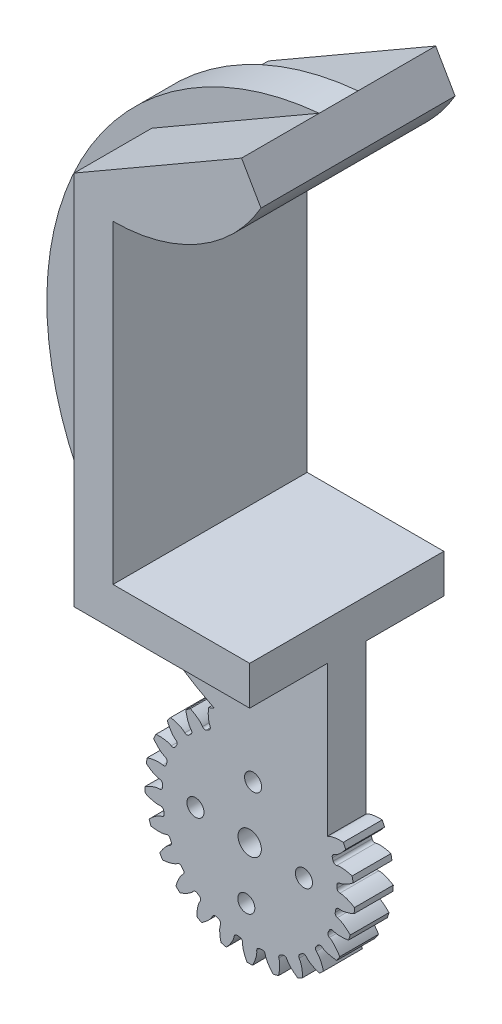
from build123d import *

# Parameters (mm, degrees)
SKETCH_1_R           = 13.5
LASHENA_DEPTH        = 5
CUT_EXTRUDEA_DEPTH   = 30
WWW_KYTOOL_CN_COUNT  = 25
EXTRUDE_2_DEPTH      = 10
EXTRUDE_2_DEPTH_BACK = 15
CUT_EXTRUDE_START    = -10
CUT_EXTRUDE_2_DEPTH  = 10
EXTRUDE_3_DEPTH      = 5
CUT_EXTRUDE_3_DEPTH  = 10
SKETCH_7_R           = 1.5
SKETCH_7_R_2         = 1.1
CUT_EXTRUDE_4_DEPTH  = 91.962557258
CUT_EXTRUDE_5_DEPTH  = 10


with BuildPart() as part:
    # 草图1 → LaShenA (new body)
    with BuildSketch(Plane.XY):
        Circle(SKETCH_1_R)
    extrude(amount=LASHENA_DEPTH)

    # SketchA → Cut-ExtrudeA (cut)
    with BuildSketch(Plane.XY.offset(5)):
        with BuildLine():
            ThreePointArc((0.168413676, 11.248739344), (0, 11.25), (-0.168413676, 11.248739344))
            ThreePointArc((-0.168413676, 11.248739344), (-0.431955465, 11.349569992), (-0.553318931, 11.60430908))
            add(Edge.make_bspline(
                [(-0.553318931, 11.60430908), (-0.556083603, 11.647298384), (-0.561050641, 11.7223845), (-0.572489313, 11.811624088), (-0.58477152, 11.87427273), (-0.59566003, 11.923918216), (-0.609744808, 11.980847357), (-0.62734241, 12.044939707), (-0.64885177, 12.116041497), (-0.674637893, 12.193990315), (-0.705068872, 12.278607345), (-0.740503482, 12.369700094), (-0.781294405, 12.467061823), (-0.827786595, 12.570472023), (-0.880317153, 12.679696595), (-0.939214753, 12.794488133), (-1.004799208, 12.914586205), (-1.077381014, 13.039717642), (-1.157260907, 13.169596858), (-1.244729425, 13.303926167), (-1.340066518, 13.442396124), (-1.443541, 13.584685884), (-1.595874213, 13.783191625), (-1.71844413, 13.930490189), (-1.804245931, 14.028565279)],
                knots=[0.117691322, 0.117691322, 0.117691322, 0.117691322, 0.158671831, 0.189773021, 0.203463493, 0.219643142, 0.238311966, 0.259469968, 0.283117146, 0.3092535, 0.337879031, 0.368993739, 0.402597623, 0.438690683, 0.47727292, 0.518344334, 0.561904924, 0.60795469, 0.656493633, 0.707521753, 0.761039049, 0.817045522, 0.875541172, 1, 1, 1, 1], degree=3))
            ThreePointArc((-1.804245931, 14.028565279), (0, 14.144113516), (1.804245931, 14.028565279))
            add(Edge.make_bspline(
                [(0.553318931, 11.60430908), (0.556083603, 11.647298384), (0.561050641, 11.7223845), (0.572489313, 11.811624088), (0.58477152, 11.87427273), (0.59566003, 11.923918216), (0.609744808, 11.980847357), (0.62734241, 12.044939707), (0.64885177, 12.116041497), (0.674637893, 12.193990315), (0.705068872, 12.278607345), (0.740503482, 12.369700094), (0.781294405, 12.467061823), (0.827786595, 12.570472023), (0.880317153, 12.679696595), (0.939214753, 12.794488133), (1.004799208, 12.914586205), (1.077381014, 13.039717642), (1.157260907, 13.169596858), (1.244729425, 13.303926167), (1.340066518, 13.442396124), (1.443541, 13.584685884), (1.595874213, 13.783191625), (1.71844413, 13.930490189), (1.804245931, 14.028565279)],
                knots=[0.117691322, 0.117691322, 0.117691322, 0.117691322, 0.158671831, 0.189773021, 0.203463493, 0.219643142, 0.238311966, 0.259469968, 0.283117146, 0.3092535, 0.337879031, 0.368993739, 0.402597623, 0.438690683, 0.47727292, 0.518344334, 0.561904924, 0.60795469, 0.656493633, 0.707521753, 0.761039049, 0.817045522, 0.875541172, 1, 1, 1, 1], degree=3))
            ThreePointArc((0.553318931, 11.60430908), (0.431955465, 11.349569992), (0.168413676, 11.248739344))
        make_face()
    cut_extrudea = extrude(amount=-CUT_EXTRUDEA_DEPTH, mode=Mode.SUBTRACT)

    # www.KYTool.cn: Cut-ExtrudeA ×25 about axis
    www_kytool_cn_axis = Axis((0, 0, -88.99), (0, 0, 1))
    for i in range(1, WWW_KYTOOL_CN_COUNT):
        add(cut_extrudea.rotate(www_kytool_cn_axis, i * 360 / WWW_KYTOOL_CN_COUNT), mode=Mode.SUBTRACT)

    # 草图3 → 凸台-拉伸2 (add, two sides: drawn at the far end of the back side and taken through both)
    with BuildSketch(Plane.XY.offset(5).offset(-EXTRUDE_2_DEPTH_BACK)):
        with BuildLine():
            Line((10, 0), (10, 30))
            Line((10, 30), (-7.6, 30))
            Line((-7.6, 30), (-7.6, 70.5))
            ThreePointArc((-7.6, 70.5), (3.4, 73.447441117), (11.452558883, 81.5))
            Line((11.452558883, 81.5), (8.952558883, 85.830127019))
            Line((8.952558883, 85.830127019), (-12.6, 73.386751346))
            Line((-12.6, 73.386751346), (-12.6, 25))
            Line((-12.6, 25), (5, 25))
            Line((5, 25), (5, 8.660254038))
            ThreePointArc((5, 8.660254038), (8.660254038, 5), (10, 0))
        make_face()
    extrude(amount=EXTRUDE_2_DEPTH + EXTRUDE_2_DEPTH_BACK)

    # 草图4 → 切除-拉伸2 (cut)
    with BuildSketch(Plane.XY.offset(15).offset(CUT_EXTRUDE_START)):
        with BuildLine():
            Line((10, 0), (10, 25))
            Line((10, 25), (5, 25))
            Line((5, 25), (5, 8.660254038))
            ThreePointArc((5, 8.660254038), (8.660254038, 5), (10, 0))
        make_face()
    extrude(amount=CUT_EXTRUDE_2_DEPTH, mode=Mode.SUBTRACT)

    # 草图5 → 凸台-拉伸3 (add)
    with BuildSketch(Plane.XY.offset(5)):
        with BuildLine():
            Line((-4.603102096, 12.742049533), (-4.633843626, 12.679806515))
            add(Edge.make_bspline(
                [(-4.633843626, 12.679806515), (-4.552342618, 12.610459129), (-4.434592405, 12.505280913), (-4.286379018, 12.362117171), (-4.18495858, 12.258967329), (-4.091567405, 12.15895255), (-4.005972686, 12.062414637), (-3.927929426, 11.969685374), (-3.857180802, 11.881086133), (-3.793458524, 11.796927492), (-3.736483312, 11.717508818), (-3.685964978, 11.643118064), (-3.641603891, 11.5740309), (-3.603087991, 11.510512064), (-3.570104131, 11.452809639), (-3.542304151, 11.401171773), (-3.519411393, 11.355793854), (-3.491934971, 11.298167895), (-3.458662682, 11.214576614), (-3.435178535, 11.143084719), (-3.421809715, 11.102133549)],
                knots=[0.358992653, 0.358992653, 0.358992653, 0.358992653, 0.461197689, 0.509736632, 0.555786399, 0.599346989, 0.640418402, 0.679000639, 0.7150937, 0.748697584, 0.779812291, 0.808437822, 0.834574177, 0.858221354, 0.879379356, 0.898048181, 0.914227829, 0.927918301, 0.959019491, 1, 1, 1, 1], degree=3))
            ThreePointArc((-3.421809715, 11.102133549), (-3.24090807, 10.885579425), (-2.960570369, 10.853456735))
            ThreePointArc((-2.960570369, 10.853456735), (-2.797761231, 10.896560563), (-2.634325067, 10.937222291))
            ThreePointArc((-2.634325067, 10.937222291), (-2.404138491, 11.100425336), (-2.349938916, 11.377343194))
            add(Edge.make_bspline(
                [(-2.349938916, 11.377343194), (-2.357952107, 11.419669455), (-2.371814275, 11.493631855), (-2.382927953, 11.5829125), (-2.386611698, 11.64664738), (-2.388179606, 11.690894071), (-2.388585842, 11.720829135), (-2.38865242, 11.733825253)],
                knots=[0.117691322, 0.117691322, 0.117691322, 0.117691322, 0.158671831, 0.189773021, 0.203463493, 0.219643142, 0.232055628, 0.232055628, 0.232055628, 0.232055628], degree=3))
            ThreePointArc((-2.38865242, 11.733825253), (1.249291383, 10.423718659), (5, 9.483931839))
            Line((5, 9.483931839), (5, 25))
            Line((5, 25), (-12.6, 25))
            Line((-12.6, 25), (-12.6, 73.386751346))
            Line((-12.6, 73.386751346), (8.952558883, 85.830127019))
            ThreePointArc((8.952558883, 85.830127019), (-25.474702124, 54.414233922), (-4.603102096, 12.742049533))
        make_face()
    extrude(amount=-EXTRUDE_3_DEPTH)

    # 草图6 → 切除-拉伸3 (cut)
    with BuildSketch(Plane(origin=(0, 0, -10), x_dir=(-1, 0, 0), z_dir=(0, 0, -1))):
        with BuildLine():
            Line((-5, 25), (-5, 8.660254038))
            ThreePointArc((-5, 8.660254038), (-8.049998244, 4.647668653), (-10, 0))
            Line((-10, 0), (-10, 25))
            Line((-10, 25), (-5, 25))
        make_face()
    extrude(amount=-CUT_EXTRUDE_3_DEPTH, mode=Mode.SUBTRACT)

    # 草图7 → 切除-拉伸4 (cut, through all)
    with BuildSketch(Plane.XY.offset(5)):
        Circle(SKETCH_7_R)
        with Locations((-6.986187099, 0.439533637)):
            Circle(SKETCH_7_R_2)
        with Locations((0.439533637, 6.986187099)):
            Circle(SKETCH_7_R_2)
        with Locations((6.986187099, -0.439533637)):
            Circle(SKETCH_7_R_2)
        with Locations((-0.439533637, -6.986187099)):
            Circle(SKETCH_7_R_2)
    extrude(amount=-CUT_EXTRUDE_4_DEPTH, mode=Mode.SUBTRACT)

    # 草图8 → 切除-拉伸5 (cut)
    with BuildSketch(Plane.XY.offset(5).offset(CUT_EXTRUDE_START)):
        with BuildLine():
            Line((10, 8.841974958), (10, 7.189321151))
            add(Edge.make_bspline(
                [(10.627276181, 8.325322874), (10.586508095, 8.226381289), (10.522864485, 8.081892325), (10.43250813, 7.896692988), (10.365747439, 7.768361366), (10.299487193, 7.648634814), (10.234124403, 7.537397543), (10.170050328, 7.434519074), (10.107649969, 7.339854463), (10.051270044, 7.258939886), (10.015352802, 7.209852679), (10, 7.189321151)],
                knots=[0.358992653, 0.358992653, 0.358992653, 0.358992653, 0.461197689, 0.509736632, 0.555786399, 0.599346989, 0.640418402, 0.679000639, 0.7150937, 0.748697584, 0.773183044, 0.773183044, 0.773183044, 0.773183044], degree=3))
            ThreePointArc((10.627276181, 8.325322874), (10.401928777, 8.605223862), (10.169211499, 8.879027958))
            ThreePointArc((10.169211499, 8.879027958), (10.084482274, 8.861065339), (10, 8.841974958))
        make_face()
    extrude(amount=CUT_EXTRUDE_5_DEPTH, mode=Mode.SUBTRACT)


solid = part.part
